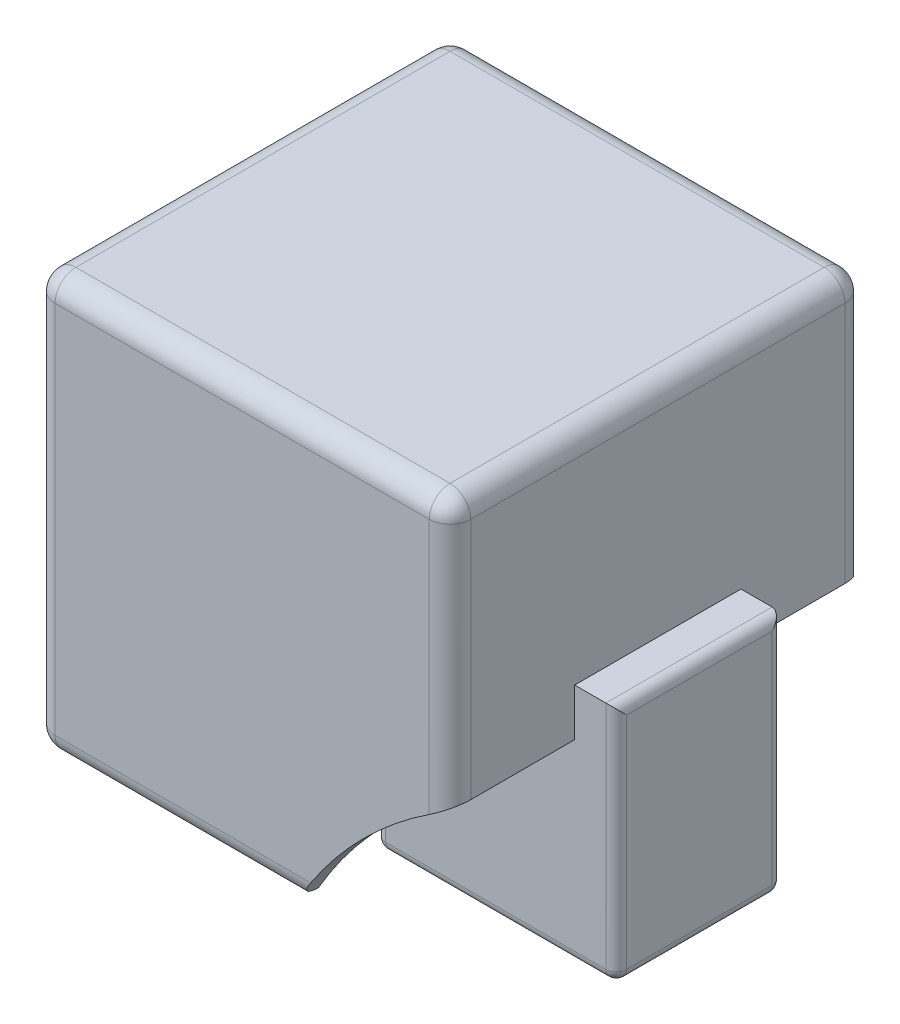
from build123d import *

# Parameters (mm, degrees)
IZIM1_W                     = 20
IZIM1_H                     = 20
Y_KSEKLIK_EKSTR_ZYON1_DEPTH = 10
BO_ALTMA1_T                 = -1
IZIM2_R                     = 20
KES_EKSTR_ZYON1_DEPTH       = 29
Y_KSEKLIK_EKSTR_ZYON2_DEPTH = 4
Y_KSEKLIK_EKSTR_ZYON3_REACH = 29.441
IZIM4_W                     = 8
IZIM4_H                     = 1.735346843
Y_KSEKLIK_EKSTR_ZYON4_START = -10.860571
IZIM6_W                     = 1.735346843
IZIM6_H                     = 8
Y_KSEKLIK_EKSTR_ZYON4_DEPTH = 10.860571
BO_ALTMA2_START             = 1.404082058
BO_ALTMA2_OUTLINE_W         = 9.860571099
BO_ALTMA2_OUTLINE_H         = 6
BO_ALTMA2_DEPTH             = 9.595917942
BO_ALTMA2_START_2           = 10
BO_ALTMA2_2_OUTLINE_W       = 1.735346843
BO_ALTMA2_2_OUTLINE_H       = 6
BO_ALTMA2_2_DEPTH           = 1
IZIM7_W                     = 1
IZIM7_H                     = 6
Y_KSEKLIK_EKSTR_ZYON5_DEPTH = 1.735346843
RADYUS1_R                   = 1
RADYUS2_R                   = 1
IZIM8_W                     = 12.756136784
IZIM8_H                     = 3
KES_EKSTR_ZYON2_DEPTH       = 10
RADYUS3_R                   = 0.5


# Read off the part's stored shape, not the designer's step: __ İç Boşaltma2
with BuildPart() as part:
    # Çizim1 → Yükseklik-Ekstrüzyon1 (new, symmetric)
    with BuildSketch(Plane.XY):
        Rectangle(IZIM1_W, IZIM1_H)
    extrude(amount=Y_KSEKLIK_EKSTR_ZYON1_DEPTH, both=True)

    # İç Boşaltma1
    bo_altma1_openings = [part.faces().sort_by_distance(p)[0] for p in [
        (0, -10, 0),
    ]]
    offset(amount=BO_ALTMA1_T, openings=bo_altma1_openings, kind=Kind.INTERSECTION)

    # Çizim2 → Kes-Ekstrüzyon1 (cut)
    with BuildSketch(Plane.XY.offset(10)):
        with Locations((20, -20)):
            Circle(IZIM2_R)
    extrude(amount=-KES_EKSTR_ZYON1_DEPTH, mode=Mode.SUBTRACT)

    # Çizim3 → Yükseklik-Ekstrüzyon2 (add, symmetric)
    with BuildSketch(Plane.XY):
        Polygon((10, -2.139428901), (12, -2.139428901), (12, -13), (2.139428901, -13), (2.139428901, -11), (2.139428901, -2.139428901), align=None)
    extrude(amount=Y_KSEKLIK_EKSTR_ZYON2_DEPTH, both=True)

    # Çizim4 → Yükseklik-Ekstrüzyon3 (add, up to next)
    with BuildSketch(Plane(origin=(12, 0, 0), x_dir=(0, 0, -1), z_dir=(1, 0, 0)), mode=Mode.PRIVATE) as y_kseklik_ekstr_zyon3_sk1:
        with Locations((0, -1.27175548)):
            Rectangle(IZIM4_W, IZIM4_H)
    y_kseklik_ekstr_zyon3_tool1 = extrude(y_kseklik_ekstr_zyon3_sk1.sketch, amount=-Y_KSEKLIK_EKSTR_ZYON3_REACH, mode=Mode.PRIVATE) - part.part
    add(y_kseklik_ekstr_zyon3_tool1.solids().sort_by_distance((12, -1.271755, 0))[0])

    # Çizim6 → Yükseklik-Ekstrüzyon4 (add)
    with BuildSketch(Plane.XZ.offset(13).offset(Y_KSEKLIK_EKSTR_ZYON4_START)):
        with Locations((1.27175548, 0)):
            Rectangle(IZIM6_W, IZIM6_H)
    extrude(amount=Y_KSEKLIK_EKSTR_ZYON4_DEPTH)

    # İç Boşaltma2 outline → İç Boşaltma2 (cut)
    with BuildSketch(Plane.YZ.offset(BO_ALTMA2_START)):
        with Locations((-8.06971445, 0)):
            Rectangle(BO_ALTMA2_OUTLINE_W, BO_ALTMA2_OUTLINE_H)
    extrude(amount=BO_ALTMA2_DEPTH, mode=Mode.SUBTRACT)

    # Bo_altma2 2 outline → Bo_altma2 2 (cut)
    with BuildSketch(Plane.YZ.offset(BO_ALTMA2_START_2)):
        with Locations((-2.27175548, 0)):
            Rectangle(BO_ALTMA2_2_OUTLINE_W, BO_ALTMA2_2_OUTLINE_H)
    extrude(amount=BO_ALTMA2_2_DEPTH, mode=Mode.SUBTRACT)

    # Çizim7 → Yükseklik-Ekstrüzyon5 (add)
    with BuildSketch(Plane.XZ.offset(3.139428901)):
        with Locations((10.5, 0)):
            Rectangle(IZIM7_W, IZIM7_H)
    extrude(amount=-Y_KSEKLIK_EKSTR_ZYON5_DEPTH)

    # Radyus1
    radyus1_edges = [part.edges().sort_by_distance(p)[0] for p in [
        (-10, 0, 10),
        (10, 3.660254038, -10),
        (10, 3.660254038, 10),
        (-10, 0, -10),
        (0, 10, -10),
        (0, 10, 10),
        (-10, 10, 0),
        (10, 10, 0),
    ]]
    fillet(radyus1_edges, radius=RADYUS1_R)

    # Radyus2
    radyus2_edges = [part.edges().sort_by_distance(p)[0] for p in [
        (-3.160254038, -10, 10),
        (-9.707106781, -10, 9.707106781),
        (-3.160254038, -10, -10),
        (-9.707106781, -10, -9.707106781),
        (-10, -10, 0),
    ]]
    fillet(radyus2_edges, radius=RADYUS2_R - 0.0001)  # a hair under: the kernel refuses the full size

    # Çizim8 → Kes-Ekstrüzyon2 (cut)
    with BuildSketch(Plane.XY.offset(4)):
        with Locations((6.78215045, -13.5)):
            Rectangle(IZIM8_W, IZIM8_H)
    extrude(amount=-KES_EKSTR_ZYON2_DEPTH, mode=Mode.SUBTRACT)

    # Radyus3
    radyus3_edges = [part.edges().sort_by_distance(p)[0] for p in [
        (12, -6.202041029, -4),
        (12, -6.202041029, 4),
        (6.202041029, -12, 4),
        (12, -12, 0),
        (6.202041029, -12, -4),
        (0.404082058, -12, 0),
        (12, -0.404082058, 0),
        (0.404082058, -7.0697145, -4),
        (0.404082058, -7.0697145, 4),
    ]]
    fillet(radyus3_edges, radius=RADYUS3_R)


solid = part.part
